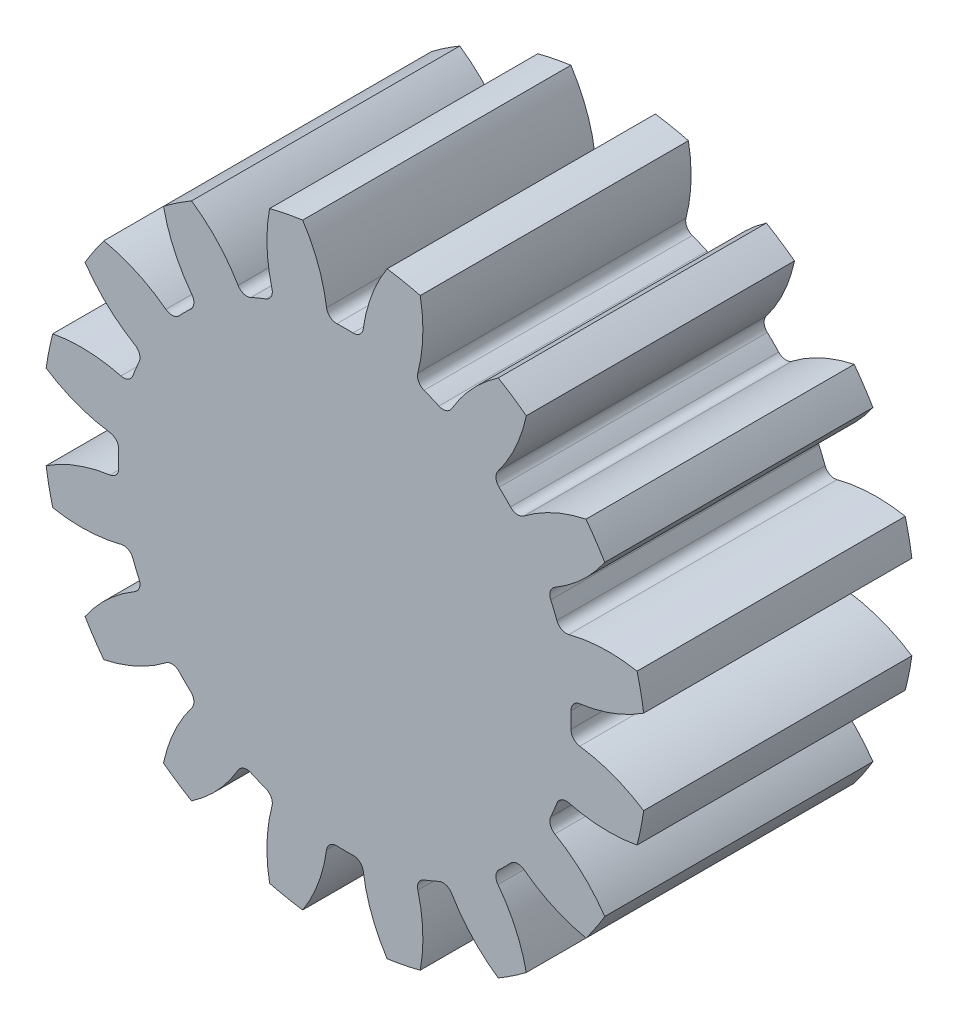
from build123d import *

# Parameters (mm, degrees)
SKETCH2_R                = 11.25
BOSS_EXTRUDE1_DEPTH      = 5
CUT_EXTRUDE1_DEPTH       = 17.67708008
FILLET1_R                = 0.375
CIRPATTERN1_COUNT        = 16
FILLET1_OF_CIRPATTERN1_R = 0.375
CUT_EXTRUDE2_DEPTH       = 9


with BuildPart() as part:
    # Sketch2 → Boss-Extrude1 (new, symmetric)
    with BuildSketch(Plane.XY):
        Circle(SKETCH2_R)
    extrude(amount=BOSS_EXTRUDE1_DEPTH, both=True)

    # Sketch3 → Cut-Extrude1 (cut, symmetric)
    with BuildSketch(Plane.XY):
        with BuildLine():
            ThreePointArc((0.647374884, 8.412628127), (0, 8.4375), (-0.647374884, 8.412628127))
            ThreePointArc((-0.647374884, 8.412628127), (-0.938843439, 9.834393243), (-1.574049944, 11.139338705))
            ThreePointArc((-1.574049944, 11.139338705), (0, 11.25), (1.574049944, 11.139338705))
            ThreePointArc((1.574049944, 11.139338705), (0.938843439, 9.834393243), (0.647374884, 8.412628127))
        make_face()
    cut_extrude1 = extrude(amount=CUT_EXTRUDE1_DEPTH, both=True, mode=Mode.SUBTRACT)

    # Fillet1
    fillet1_edges = [part.edges().sort_by_distance(p)[0] for p in [
        (0.647374884, 8.412628127, 0),
        (-0.647374884, 8.412628127, 0),
    ]]
    fillet(fillet1_edges, radius=FILLET1_R)

    # CirPattern1: Cut-Extrude1 ×16 about axis
    cirpattern1_axis = Axis((0, 0, -11), (0, 0, 1))
    for i in range(1, CIRPATTERN1_COUNT):
        add(cut_extrude1.rotate(cirpattern1_axis, i * 360 / CIRPATTERN1_COUNT), mode=Mode.SUBTRACT)

    # Fillet1 of CirPattern1
    fillet1_of_cirpattern1_edges = [part.edges().sort_by_distance(p)[0] for p in [
        (-2.621277002, 8.019994584, 0),
        (-3.817469812, 7.524515299, 0),
        (-5.490863226, 6.406389567, 0),
        (-6.406389567, 5.490863226, 0),
        (-7.524515299, 3.817469812, 0),
        (-8.019994584, 2.621277002, 0),
        (-8.412628127, 0.647374884, 0),
        (-8.412628127, -0.647374884, 0),
        (-8.019994584, -2.621277002, 0),
        (-7.524515299, -3.817469812, 0),
        (-6.406389567, -5.490863226, 0),
        (-5.490863226, -6.406389567, 0),
        (-3.817469812, -7.524515299, 0),
        (-2.621277002, -8.019994584, 0),
        (-0.647374884, -8.412628127, 0),
        (0.647374884, -8.412628127, 0),
        (2.621277002, -8.019994584, 0),
        (3.817469812, -7.524515299, 0),
        (5.490863226, -6.406389567, 0),
        (6.406389567, -5.490863226, 0),
        (7.524515299, -3.817469812, 0),
        (8.019994584, -2.621277002, 0),
        (8.412628127, -0.647374884, 0),
        (8.412628127, 0.647374884, 0),
        (8.019994584, 2.621277002, 0),
        (7.524515299, 3.817469812, 0),
        (6.406389567, 5.490863226, 0),
        (5.490863226, 6.406389567, 0),
        (3.817469812, 7.524515299, 0),
        (2.621277002, 8.019994584, 0),
    ]]
    fillet(fillet1_of_cirpattern1_edges, radius=FILLET1_OF_CIRPATTERN1_R)

    # Sketch4 → Cut-Extrude2 (cut)
    with BuildSketch(Plane(origin=(0, 0, -5), x_dir=(-1, 0, 0), z_dir=(0, 0, -1))):
        with BuildLine():
            Line((-1.54677083, 1.9), (1.54677083, 1.9))
            ThreePointArc((1.54677083, 1.9), (0, -2.45), (-1.54677083, 1.9))
        make_face()
    extrude(amount=-CUT_EXTRUDE2_DEPTH, mode=Mode.SUBTRACT)


solid = part.part
